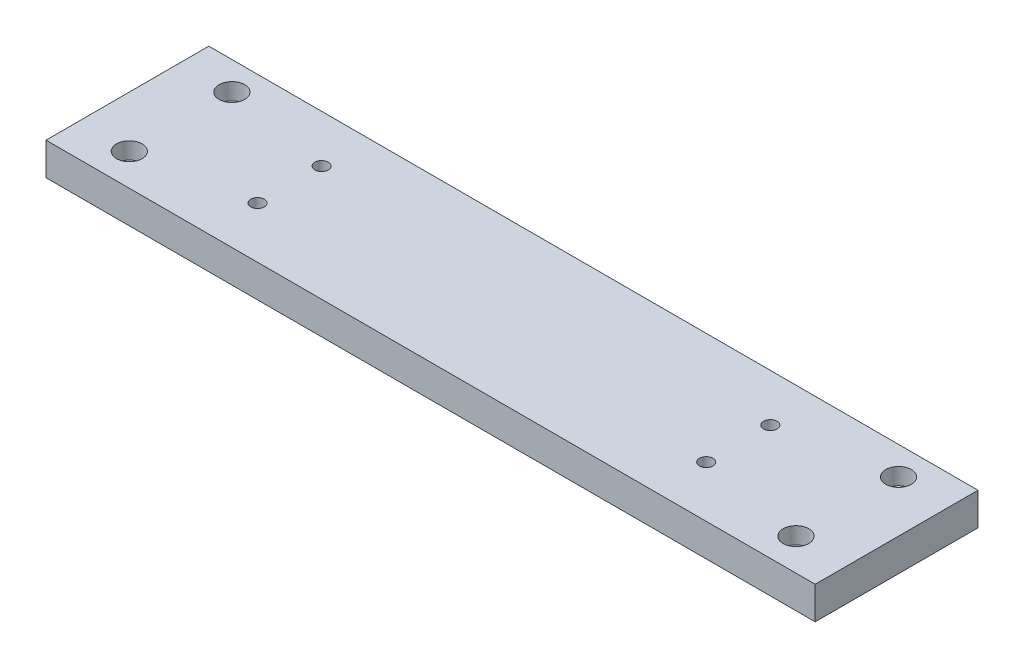
from build123d import *

# Parameters (mm, degrees)
SKETCH1_W           = 600
SKETCH1_H           = 127
BOSS_EXTRUDE1_DEPTH = 25.4
SKETCH2_R           = 6
CUT_EXTRUDE1_DEPTH  = 25.4
SKETCH3_R           = 5.25
CUT_EXTRUDE2_DEPTH  = 25.4
SKETCH4_R           = 10
CUT_EXTRUDE3_DEPTH  = 13


with BuildPart() as part:
    # Sketch1 → Boss-Extrude1 (new body)
    with BuildSketch(Plane(origin=(0, 0, 0), x_dir=(1, 0, 0), z_dir=(0, 1, 0))):
        with Locations((300, 63.5)):
            Rectangle(SKETCH1_W, SKETCH1_H)
    extrude(amount=BOSS_EXTRUDE1_DEPTH)

    # Sketch2 → Cut-Extrude1 (cut)
    with BuildSketch(Plane(origin=(0, 25.4, 0), x_dir=(1, 0, 0), z_dir=(0, 1, 0))):
        with Locations((40, 105)):
            Circle(SKETCH2_R)
        with Locations((40, 25)):
            Circle(SKETCH2_R)
        with Locations((560, 25)):
            Circle(SKETCH2_R)
        with Locations((560, 105)):
            Circle(SKETCH2_R)
    extrude(amount=-CUT_EXTRUDE1_DEPTH, mode=Mode.SUBTRACT)

    # Sketch3 → Cut-Extrude2 (cut)
    with BuildSketch(Plane(origin=(0, 25.4, 0), x_dir=(1, 0, 0), z_dir=(0, 1, 0))):
        with Locations((125, 90)):
            Circle(SKETCH3_R)
        with Locations((125, 40)):
            Circle(SKETCH3_R)
        with Locations((475, 40)):
            Circle(SKETCH3_R)
        with Locations((475, 90)):
            Circle(SKETCH3_R)
    extrude(amount=-CUT_EXTRUDE2_DEPTH, mode=Mode.SUBTRACT)

    # Sketch4 → Cut-Extrude3 (cut)
    with BuildSketch(Plane(origin=(0, 25.4, 0), x_dir=(1, 0, 0), z_dir=(0, 1, 0))):
        with Locations((40, 105)):
            Circle(SKETCH4_R)
        with Locations((40, 25)):
            Circle(SKETCH4_R)
        with Locations((560, 25)):
            Circle(SKETCH4_R)
        with Locations((560, 105)):
            Circle(SKETCH4_R)
    extrude(amount=-CUT_EXTRUDE3_DEPTH, mode=Mode.SUBTRACT)


solid = part.part
